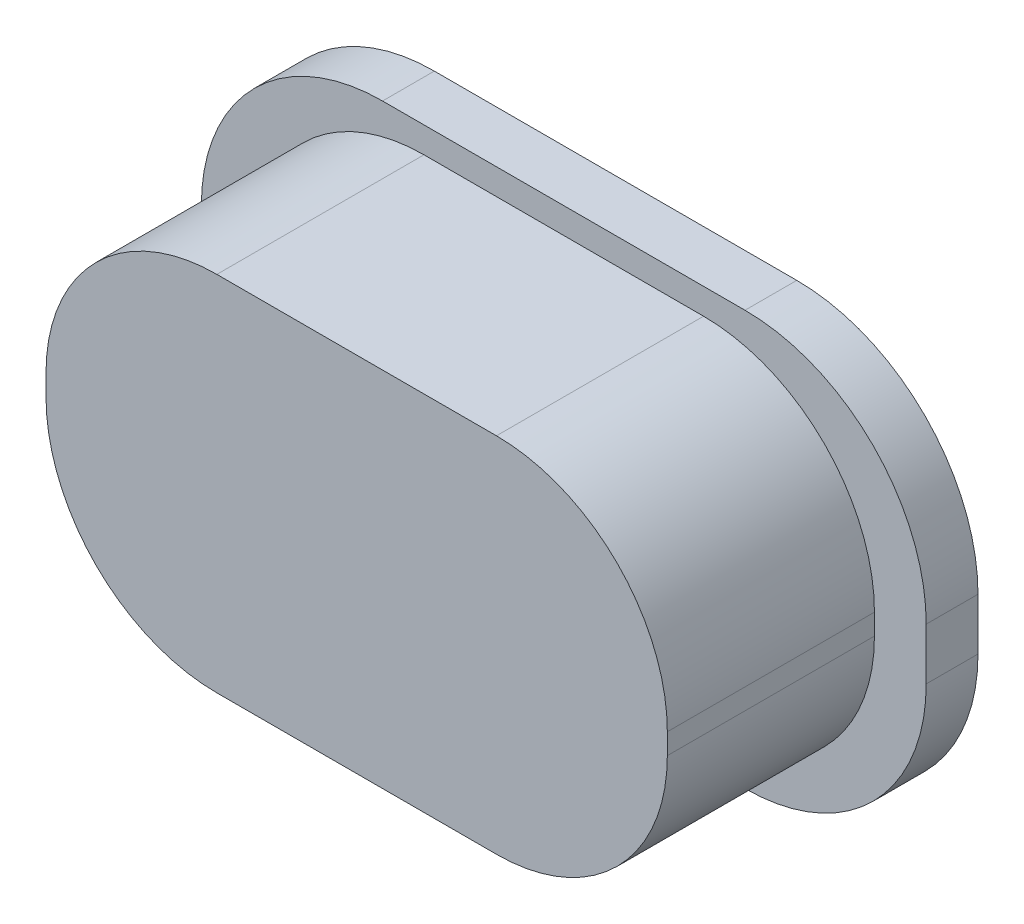
from build123d import *

# Parameters (mm, degrees)
SKETCH1_W           = 14
SKETCH1_H           = 8
BOSS_EXTRUDE1_DEPTH = 1
SKETCH2_W           = 12
SKETCH2_H           = 7
BOSS_EXTRUDE2_DEPTH = 4
FILLET2_R           = 3.3
FILLET1_R           = 3.5


with BuildPart() as part:
    # Sketch1 → Boss-Extrude1 (new body)
    with BuildSketch(Plane.XY):
        Rectangle(SKETCH1_W, SKETCH1_H)
    extrude(amount=BOSS_EXTRUDE1_DEPTH)

    # Sketch2 → Boss-Extrude2 (add)
    with BuildSketch(Plane.XY.offset(1)):
        Rectangle(SKETCH2_W, SKETCH2_H)
    extrude(amount=BOSS_EXTRUDE2_DEPTH)

    # Fillet2
    fillet2_edges = [part.edges().sort_by_distance(p)[0] for p in [
        (6, 3.5, 3),
        (-6, 3.5, 3),
        (6, -3.5, 3),
        (-6, -3.5, 3),
    ]]
    fillet(fillet2_edges, radius=FILLET2_R)

    # Fillet1
    fillet1_edges = [part.edges().sort_by_distance(p)[0] for p in [
        (7, -4, 0.5),
        (-7, -4, 0.5),
        (7, 4, 0.5),
        (-7, 4, 0.5),
    ]]
    fillet(fillet1_edges, radius=FILLET1_R)


solid = part.part
